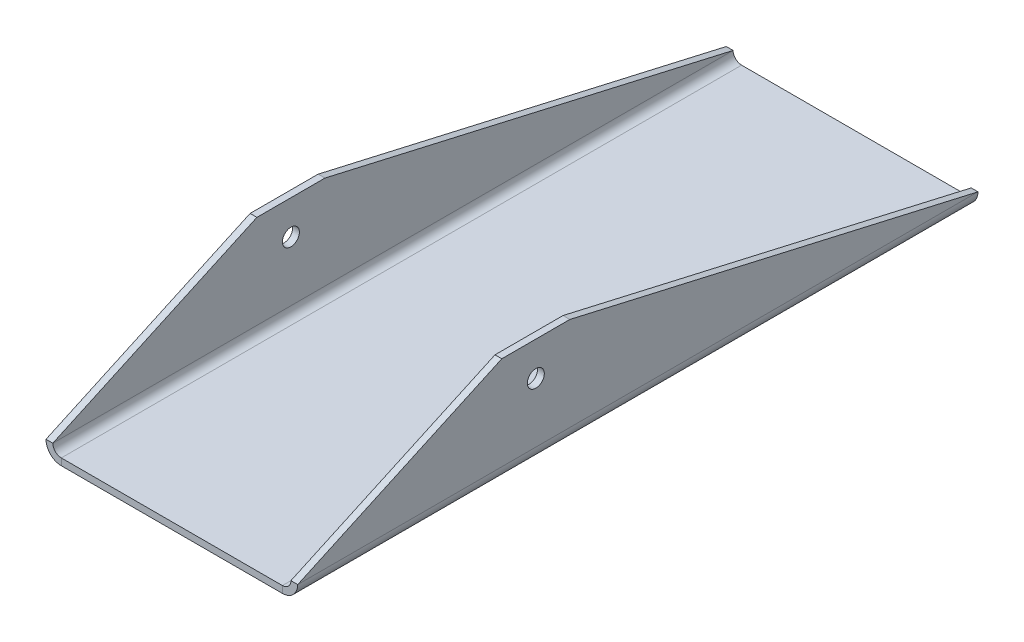
from build123d import *

# Parameters (mm, degrees)
BASE_FLANGE1_DEPTH = 254
SKETCH7_R          = 3.175
CUT_EXTRUDE1_DEPTH = 274.495613128


# Sheet-metal steps are written as plain solids
with BuildPart() as part:
    # Sketch2 → Base-Flange1 (new body)
    with BuildSketch(Plane.XY):
        with BuildLine():
            Line((0, 38.1), (0, 3.175))
            ThreePointArc((0, 3.175), (0.92993597, 0.92993597), (3.175, 0))
            Line((3.175, 0), (85.725, 0))
            ThreePointArc((85.725, 0), (87.97006403, 0.92993597), (88.9, 3.175))
            Line((88.9, 3.175), (88.9, 38.1))
            Line((88.9, 38.1), (91.44, 38.1))
            Line((91.44, 38.1), (91.44, 3.175))
            ThreePointArc((91.44, 3.175), (89.766115254, -0.866115254), (85.725, -2.54))
            Line((85.725, -2.54), (3.175, -2.54))
            ThreePointArc((3.175, -2.54), (-0.866115254, -0.866115254), (-2.54, 3.175))
            Line((-2.54, 3.175), (-2.54, 38.1))
            Line((-2.54, 38.1), (0, 38.1))
        make_face()
    extrude(amount=BASE_FLANGE1_DEPTH)

    # Sketch7 → Cut-Extrude1 (cut, through all)
    with BuildSketch(Plane(origin=(91.44, 0, 0), x_dir=(0, 0, -1), z_dir=(1, 0, 0))):
        with Locations(Location((-165.1, 25.4, 0), (0, 0, 90))):
            Circle(SKETCH7_R)
        Polygon((-254, 38.1), (-254, 3.175), (-177.8, 38.1), align=None)
        Polygon((0, 38.1), (0, 3.175), (-152.4, 38.1), align=None)
    extrude(amount=-CUT_EXTRUDE1_DEPTH, mode=Mode.SUBTRACT)


solid = part.part
